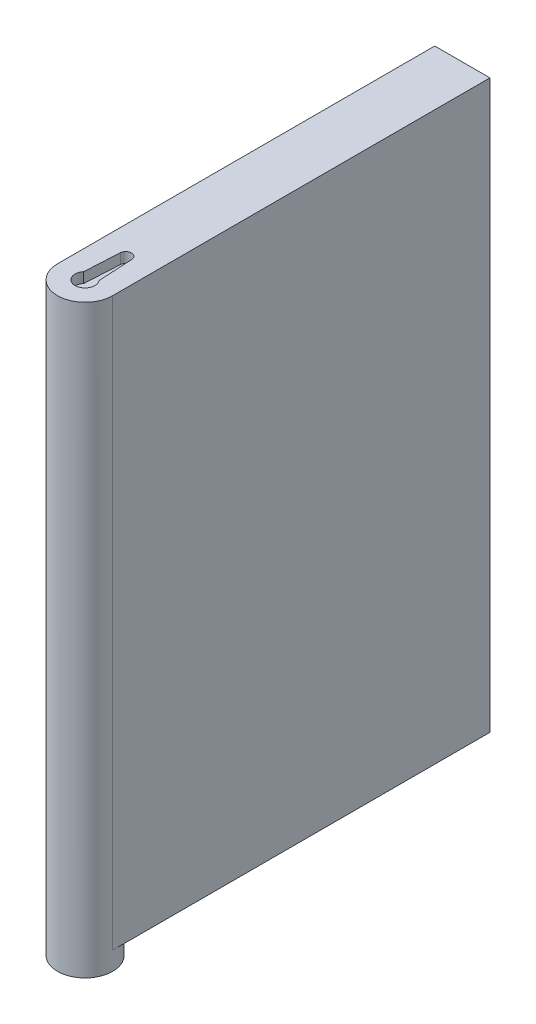
from build123d import *

# Parameters (mm, degrees)
BOSS_EXTRUDE1_DEPTH = 97.79
SKETCH2_R           = 9.525
BOSS_EXTRUDE2_DEPTH = 6.35
CUT_EXTRUDE1_DEPTH  = 3.556


with BuildPart() as part:
    # Sketch1 → Boss-Extrude1 (new, symmetric)
    with BuildSketch(Plane(origin=(0, 0, 0), x_dir=(1, 0, 0), z_dir=(0, 1, 0))):
        with BuildLine():
            ThreePointArc((-9.525, -60.325), (-6.735192091, -67.060192091), (0, -69.85))
            ThreePointArc((0, -69.85), (6.735192091, -67.060192091), (9.525, -60.325))
            Line((9.525, -60.325), (9.525, 69.85))
            Line((9.525, 69.85), (-9.525, 69.85))
            Line((-9.525, 69.85), (-9.525, -60.325))
        make_face()
    extrude(amount=BOSS_EXTRUDE1_DEPTH, both=True)

    # Sketch2 → Boss-Extrude2 (add)
    with BuildSketch(Plane.XZ.offset(97.79)):
        with Locations((0, 60.325)):
            Circle(SKETCH2_R)
    extrude(amount=BOSS_EXTRUDE2_DEPTH)

    # Sketch3 → Cut-Extrude1 (cut)
    with BuildSketch(Plane(origin=(0, 97.79, 0), x_dir=(1, 0, 0), z_dir=(0, 1, 0))):
        with BuildLine():
            Line((-2.653120508, -58.137948911), (-1.999654839, -46.187925743))
            ThreePointArc((-1.999654839, -46.187925743), (-0.002556973, -44.297129021), (1.994386918, -46.188088362))
            Line((1.994386918, -46.188088362), (2.646879487, -58.138164702))
            ThreePointArc((2.646879487, -58.138164702), (-0.003350921, -63.797129005), (-2.653120508, -58.137948911))
        make_face()
    extrude(amount=-CUT_EXTRUDE1_DEPTH, mode=Mode.SUBTRACT)


solid = part.part
